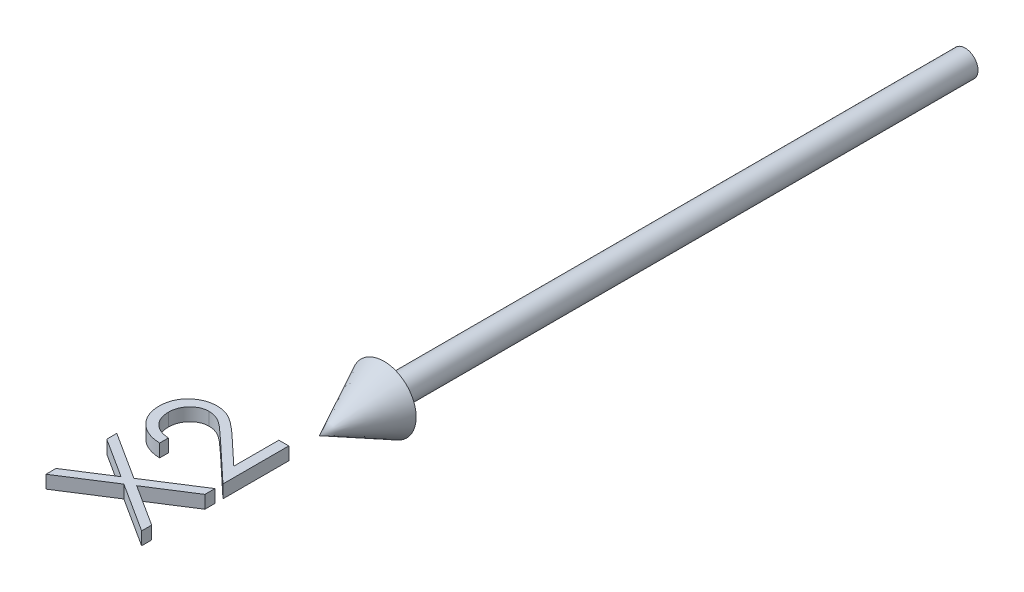
from build123d import *

# Parameters (mm, degrees)
BOSS_EXTRUDE1_DEPTH        = 1
BOSS_EXTRUDE1_DEPTH_BACK   = 1
BOSS_EXTRUDE1_2_DEPTH      = 1
BOSS_EXTRUDE1_2_DEPTH_BACK = 1


with BuildPart() as part:
    # Sketch2 → Revolve1 (revolve)
    with BuildSketch(Plane(origin=(0, 0, 0), x_dir=(1, 0, 0), z_dir=(0, 1, 0))):
        Polygon((0, -100), (5, -90), (2, -90), (2, 0), (0, 0), align=None)
    revolve(axis=Axis((0, 0, -41.949952025), (0, 0, 1)))


with BuildPart() as body_2:
    # Sketch3 → Boss-Extrude1 (new, two sides: drawn at the far end of the back side and taken through both)
    with BuildSketch(Plane(origin=(0, 0, 0), x_dir=(1, 0, 0), z_dir=(0, 1, 0)).offset(-BOSS_EXTRUDE1_DEPTH_BACK)):
        with BuildLine():
            Line((-10.384615385, -112.991265497), (-10.384615385, -114.337419343))
            add(Edge.make_bspline(
                [(-10.384615385, -114.337419343), (-10.563204904, -114.32864583), (-10.913949966, -114.311414884), (-11.425338136, -114.230722216), (-11.914144417, -114.115261314), (-12.376444048, -113.952012225), (-12.81632465, -113.749271035), (-13.232039003, -113.506142346), (-13.622001241, -113.218168701), (-13.982596283, -112.891568412), (-14.313400158, -112.536845673), (-14.599065485, -112.154105933), (-14.840426933, -111.751912959), (-15.042203684, -111.331486963), (-15.193660166, -110.888084548), (-15.306038622, -110.425729443), (-15.373651532, -109.942390287), (-15.380919185, -109.613075907), (-15.384615385, -109.44559242)],
                knots=[0, 0, 0, 0, 1.10065271, 2.161652631, 3.183658789, 4.190468796, 5.17591951, 6.163126047, 7.15150782, 8.156236427, 9.156009102, 10.134482811, 11.092018607, 12.041330605, 13.001268258, 13.972401359, 14.968799086, 16, 16, 16, 16], degree=3))
            add(Edge.make_bspline(
                [(-15.384615385, -109.44559242), (-15.380796104, -109.281103385), (-15.373291355, -108.957888306), (-15.307873473, -108.486357704), (-15.207626401, -108.036404422), (-15.059076032, -107.613127777), (-14.872677813, -107.21218376), (-14.640867206, -106.838536725), (-14.37461271, -106.483151497), (-14.060552476, -106.163469762), (-13.725449413, -105.869803523), (-13.367562158, -105.616680981), (-12.997495718, -105.398689855), (-12.612359334, -105.220270928), (-12.210898815, -105.085021447), (-11.7969631, -104.984814544), (-11.365775091, -104.927530863), (-11.073881456, -104.918787569), (-10.925480769, -104.91434242)],
                knots=[0, 0, 0, 0, 1.111674182, 2.184400057, 3.212814286, 4.223731311, 5.211378316, 6.196328225, 7.191884489, 8.207283132, 9.220262353, 10.201199469, 11.166417575, 12.120932471, 13.06540007, 14.026332106, 14.996573967, 16, 16, 16, 16], degree=3))
            add(Edge.make_bspline(
                [(-10.925480769, -104.91434242), (-10.716561568, -104.921599375), (-10.302389402, -104.935985935), (-9.693752958, -105.059045878), (-9.104071894, -105.251251573), (-8.629467281, -105.482648308), (-8.247074226, -105.716147542), (-7.93207523, -105.926353799), (-7.592995253, -106.173834475), (-7.228461871, -106.456475206), (-6.843248958, -106.779143466), (-6.429497135, -107.133456376), (-5.994856958, -107.52856419), (-5.697798463, -107.805629755), (-5.543870192, -107.949198189)],
                knots=[0, 0, 0, 0, 1.184416499, 2.348048165, 3.509039915, 4.696071444, 5.333504901, 6.05069495, 6.844171097, 7.714965912, 8.667477798, 9.695072654, 10.805644396, 12, 12, 12, 12], degree=3))
            Line((-5.543870192, -107.949198189), (-1.538461538, -111.702202997))
            Line((-1.538461538, -111.702202997), (-1.538461538, -104.722034728))
            Line((-1.538461538, -104.722034728), (0, -104.722034728))
            Line((0, -104.722034728), (0, -114.91434242))
            Line((0, -114.91434242), (-6.207932692, -109.097034728))
            add(Edge.make_bspline(
                [(-6.207932692, -109.097034728), (-6.355782578, -108.955400927), (-6.639771949, -108.683351382), (-7.054384635, -108.29856891), (-7.439025524, -107.952973246), (-7.792967874, -107.644327277), (-8.121388879, -107.37932654), (-8.413651895, -107.144159831), (-8.682599539, -106.95573587), (-8.994345027, -106.751241317), (-9.374969243, -106.553181397), (-9.840113626, -106.382985585), (-10.318944709, -106.279207663), (-10.642524868, -106.266758368), (-10.805288462, -106.260496266)],
                knots=[0, 0, 0, 0, 1.329631726, 2.553950428, 3.673215718, 4.687767853, 5.603093632, 6.413772471, 7.123043292, 7.734684054, 8.834405432, 9.900288307, 10.943827018, 12, 12, 12, 12], degree=3))
            add(Edge.make_bspline(
                [(-10.805288462, -106.260496266), (-10.907637312, -106.263220876), (-11.109347242, -106.268590559), (-11.405086209, -106.315980691), (-11.690363983, -106.387597146), (-11.966058065, -106.49021968), (-12.229396573, -106.625677138), (-12.48070006, -106.790563052), (-12.723652768, -106.980806181), (-12.951452617, -107.200883049), (-13.160086355, -107.442646705), (-13.344903864, -107.698050632), (-13.499357196, -107.968265365), (-13.625972184, -108.252151603), (-13.725295246, -108.5489179), (-13.794117729, -108.859138236), (-13.837328375, -109.181955449), (-13.843174826, -109.402384716), (-13.846153846, -109.514702997)],
                knots=[0, 0, 0, 0, 0.991446411, 1.95395049, 2.89581595, 3.838931463, 4.798493298, 5.75982156, 6.748411868, 7.785213223, 8.824556874, 9.840280684, 10.836137867, 11.835679398, 12.848801643, 13.863922112, 14.911575587, 16, 16, 16, 16], degree=3))
            add(Edge.make_bspline(
                [(-13.846153846, -109.514702997), (-13.843210339, -109.632036008), (-13.837429778, -109.862458669), (-13.793644926, -110.200052057), (-13.727267069, -110.524325229), (-13.621844545, -110.830439742), (-13.497282594, -111.12502431), (-13.339040059, -111.40179002), (-13.155158717, -111.665332029), (-12.941940801, -111.911315581), (-12.702375061, -112.135976853), (-12.438357077, -112.3361468), (-12.151787569, -112.50989429), (-11.843842673, -112.661699082), (-11.511456406, -112.784923454), (-11.155884194, -112.879098155), (-10.778648675, -112.953612076), (-10.518141312, -112.978505895), (-10.384615385, -112.991265497)],
                knots=[0, 0, 0, 0, 1.030878251, 2.024474673, 2.987898669, 3.934362936, 4.864849709, 5.795128259, 6.730474222, 7.685293701, 8.650606017, 9.611896181, 10.591709709, 11.591680886, 12.625074257, 13.701333388, 14.821793024, 16, 16, 16, 16], degree=3))
        make_face()
    extrude(amount=BOSS_EXTRUDE1_DEPTH + BOSS_EXTRUDE1_DEPTH_BACK)


with BuildPart() as body_3:
    # Sketch3 → Boss-Extrude1 2 (new, two sides: drawn at the far end of the back side and taken through both)
    with BuildSketch(Plane(origin=(0, 0, 0), x_dir=(1, 0, 0), z_dir=(0, 1, 0)).offset(-BOSS_EXTRUDE1_2_DEPTH_BACK)):
        Polygon((-15, -127.318188574), (-15, -125.764702997), (-8.864182692, -121.837419343), (-15, -117.910135689), (-15, -116.356650112), (-7.650240385, -121.059174151), (0, -116.16434242), (0, -117.717827997), (-6.436298077, -121.837419343), (0, -125.957010689), (0, -127.510496266), (-7.650240385, -122.612659728), align=None)
    extrude(amount=BOSS_EXTRUDE1_2_DEPTH + BOSS_EXTRUDE1_2_DEPTH_BACK)


solid = Compound([part.part, body_2.part, body_3.part])
